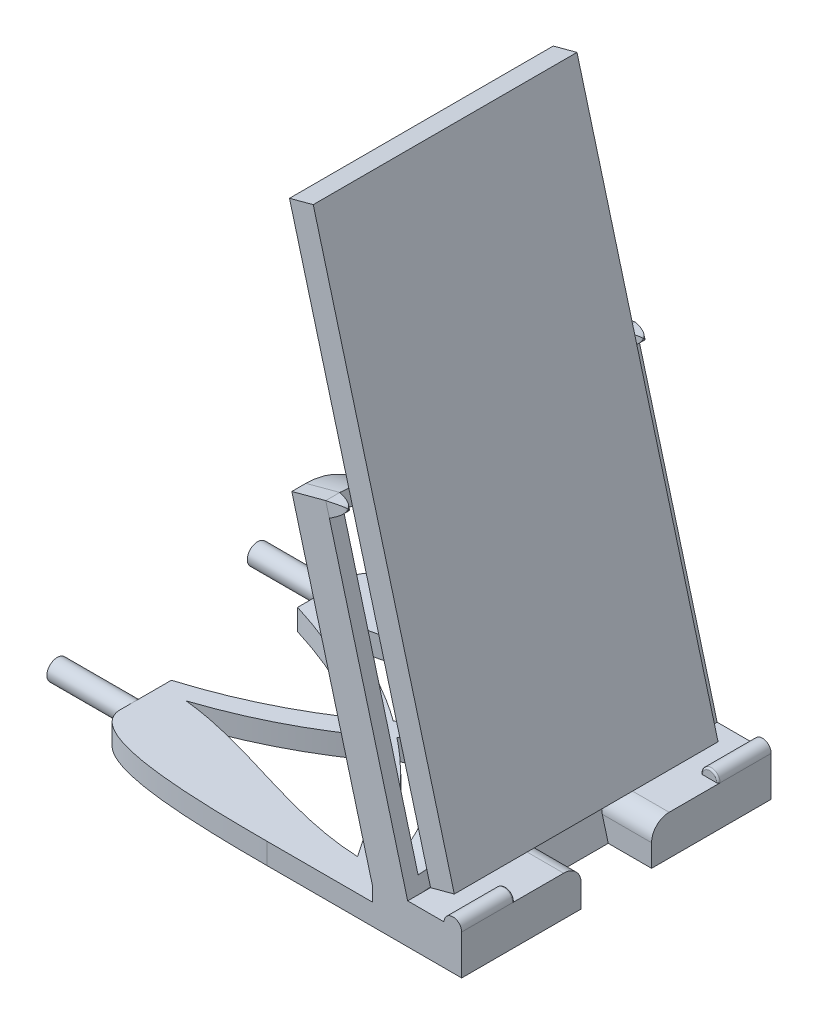
from build123d import *

# Parameters (mm, degrees)
BOSS_EXTRUDE1_DEPTH    = 44
CUT_EXTRUDE1_REACH     = 202.557
LOFT3_START            = -150.619852478
LOFT3_DEPTH            = 4.0000002
LOFT3_START_2          = 39
LOFT3_2_DEPTH          = 6
CUT_EXTRUDE2_REACH     = 181.911
SKETCH13_W             = 21.9
SKETCH13_H             = 25.5
SKETCH13_H_2           = 12.5
CUT_EXTRUDE4_START     = -21.9
CUT_EXTRUDE4_OUTLINE_W = 6
CUT_EXTRUDE4_OUTLINE_H = 6
CUT_EXTRUDE4_OUTLINE_R = 2.95
CUT_EXTRUDE4_DEPTH     = 21.9
CUT_EXTRUDE5_REACH     = 181.911
SKETCH19_W             = 5
SKETCH19_H             = 58
CUT_EXTRUDE6_DEPTH     = 178.243769107
FILLET3_R              = 0.5
SKETCH21_W             = 75
SKETCH21_H             = 155
BOSS_EXTRUDE15_DEPTH   = 6.99
SKETCH23_W             = 14.829629132
SKETCH23_H             = 20
CUT_EXTRUDE8_DEPTH     = 219.657815944
FILLET4_R              = 5
CUT_EXTRUDE12_DEPTH    = 6


with BuildPart() as part:
    # Sketch1 → Boss-Extrude1 (new, symmetric)
    with BuildSketch(Plane.XY):
        with BuildLine():
            Line((99.75217012, 182.661658891), (122.705142442, 97))
            Line((122.705142442, 97), (122.705142442, 93))
            Line((122.705142442, 93), (17.549524393, 93))
            Line((17.549524393, 93), (17.549524393, 87))
            Line((17.549524393, 87), (122.705142442, 87))
            Line((122.705142442, 87), (148.057904246, 87))
            Line((148.057904246, 87), (148.057904246, 98.316524976))
            ThreePointArc((148.057904246, 98.316524976), (145.557904246, 100.816524976), (143.057904246, 98.316524976))
            Line((143.057904246, 98.316524976), (132.705142442, 98.316524976))
            Line((132.705142442, 98.316524976), (109.411428383, 185.249849342))
            Line((109.411428383, 185.249849342), (99.75217012, 182.661658891))
        make_face()
    extrude(amount=BOSS_EXTRUDE1_DEPTH, both=True)

    # Sketch2 → Cut-Extrude1 (cut, up to next)
    with BuildSketch(Plane(origin=(148.394714749, 39.762243978, 0), x_dir=(0, 0, -1), z_dir=(0.96592582628907, 0.25881904510251486, 0)), mode=Mode.PRIVATE) as cut_extrude1_sk1:
        with BuildLine():
            ThreePointArc((-23, 125.119852378), (-26.295529926, 139.985014762), (-40, 146.619852378))
            Line((-40, 146.619852378), (-40, 64.619852378))
            ThreePointArc((-40, 64.619852378), (-26.295529926, 71.254689994), (-23, 86.119852378))
            ThreePointArc((-23, 86.119852378), (-21.898959078, 97.391608348), (-14.116878768, 105.619852378))
            ThreePointArc((-14.116878768, 105.619852378), (-21.898959078, 113.848096408), (-23, 125.119852378))
        make_face()
    cut_extrude1_tool1 = extrude(cut_extrude1_sk1.sketch, amount=-CUT_EXTRUDE1_REACH, mode=Mode.PRIVATE) & part.part
    # Sketch2 → Cut-Extrude1 (cut, up to next)
    with BuildSketch(Plane(origin=(148.394714749, 39.762243978, 0), x_dir=(0, 0, -1), z_dir=(0.96592582628907, 0.25881904510251486, 0)), mode=Mode.PRIVATE) as cut_extrude1_sk2:
        with BuildLine():
            Line((-4, 150.619852378), (-40, 150.619852378))
            ThreePointArc((-40, 150.619852378), (-24.972941073, 144.291630865), (-19, 129.119852378))
            ThreePointArc((-19, 129.119852378), (-15.264861722, 116.66035106), (-4.909694749, 108.788823379))
            ThreePointArc((-4.909694749, 108.788823379), (-3.505165356, 110.858705523), (-2.222583748, 113.0062854))
            ThreePointArc((-2.222583748, 113.0062854), (-7.034865709, 131.627661749), (-4, 150.619852378))
        make_face()
    cut_extrude1_tool2 = extrude(cut_extrude1_sk2.sketch, amount=-CUT_EXTRUDE1_REACH, mode=Mode.PRIVATE) & part.part
    # Sketch2 → Cut-Extrude1 (cut, up to next)
    with BuildSketch(Plane(origin=(148.394714749, 39.762243978, 0), x_dir=(0, 0, -1), z_dir=(0.96592582628907, 0.25881904510251486, 0)), mode=Mode.PRIVATE) as cut_extrude1_sk3:
        with BuildLine():
            ThreePointArc((-19, 82.119852378), (-24.972941073, 66.948073891), (-40, 60.619852378))
            Line((-40, 60.619852378), (-4, 60.619852378))
            ThreePointArc((-4, 60.619852378), (-7.034865709, 79.612043008), (-2.222583748, 98.233419356))
            ThreePointArc((-2.222583748, 98.233419356), (-3.505165356, 100.380999233), (-4.909694749, 102.450881377))
            ThreePointArc((-4.909694749, 102.450881377), (-15.264861722, 94.579353697), (-19, 82.119852378))
        make_face()
    cut_extrude1_tool3 = extrude(cut_extrude1_sk3.sketch, amount=-CUT_EXTRUDE1_REACH, mode=Mode.PRIVATE) & part.part
    # Sketch2 → Cut-Extrude1 (cut, up to next)
    with BuildSketch(Plane(origin=(148.394714749, 39.762243978, 0), x_dir=(0, 0, -1), z_dir=(0.96592582628907, 0.25881904510251486, 0)), mode=Mode.PRIVATE) as cut_extrude1_sk4:
        with BuildLine():
            Line((40, 150.619852378), (4, 150.619852378))
            ThreePointArc((4, 150.619852378), (7.034865709, 131.627661749), (2.222583748, 113.0062854))
            ThreePointArc((2.222583748, 113.0062854), (3.505165356, 110.858705523), (4.909694749, 108.788823379))
            ThreePointArc((4.909694749, 108.788823379), (15.264861722, 116.66035106), (19, 129.119852378))
            ThreePointArc((19, 129.119852378), (24.972941073, 144.291630865), (40, 150.619852378))
        make_face()
    cut_extrude1_tool4 = extrude(cut_extrude1_sk4.sketch, amount=-CUT_EXTRUDE1_REACH, mode=Mode.PRIVATE) & part.part
    # Sketch2 → Cut-Extrude1 (cut, up to next)
    with BuildSketch(Plane(origin=(148.394714749, 39.762243978, 0), x_dir=(0, 0, -1), z_dir=(0.96592582628907, 0.25881904510251486, 0)), mode=Mode.PRIVATE) as cut_extrude1_sk5:
        with BuildLine():
            ThreePointArc((2.222583748, 98.233419356), (7.034865709, 79.612043008), (4, 60.619852378))
            Line((4, 60.619852378), (40, 60.619852378))
            ThreePointArc((40, 60.619852378), (24.972941073, 66.948073891), (19, 82.119852378))
            ThreePointArc((19, 82.119852378), (15.264861722, 94.579353697), (4.909694749, 102.450881377))
            ThreePointArc((4.909694749, 102.450881377), (3.505165356, 100.380999233), (2.222583748, 98.233419356))
        make_face()
    cut_extrude1_tool5 = extrude(cut_extrude1_sk5.sketch, amount=-CUT_EXTRUDE1_REACH, mode=Mode.PRIVATE) & part.part
    # Sketch2 → Cut-Extrude1 (cut, up to next)
    with BuildSketch(Plane(origin=(148.394714749, 39.762243978, 0), x_dir=(0, 0, -1), z_dir=(0.96592582628907, 0.25881904510251486, 0)), mode=Mode.PRIVATE) as cut_extrude1_sk6:
        with BuildLine():
            ThreePointArc((0, 109.006393363), (-0.381722689, 108.402081473), (-0.772574463, 107.803633513))
            ThreePointArc((-0.772574463, 107.803633513), (-0.386696105, 107.755881916), (0, 107.715280877))
            ThreePointArc((0, 107.715280877), (0.386696105, 107.755881916), (0.772574463, 107.803633513))
            ThreePointArc((0.772574463, 107.803633513), (0.381722689, 108.402081473), (0, 109.006393363))
        make_face()
    cut_extrude1_tool6 = extrude(cut_extrude1_sk6.sketch, amount=-CUT_EXTRUDE1_REACH, mode=Mode.PRIVATE) & part.part
    # Sketch2 → Cut-Extrude1 (cut, up to next)
    with BuildSketch(Plane(origin=(148.394714749, 39.762243978, 0), x_dir=(0, 0, -1), z_dir=(0.96592582628907, 0.25881904510251486, 0)), mode=Mode.PRIVATE) as cut_extrude1_sk7:
        with BuildLine():
            ThreePointArc((0, 103.524423879), (-0.386696105, 103.48382284), (-0.772574463, 103.436071243))
            ThreePointArc((-0.772574463, 103.436071243), (-0.381722689, 102.837623283), (0, 102.233311394))
            ThreePointArc((0, 102.233311394), (0.381722689, 102.837623283), (0.772574463, 103.436071243))
            ThreePointArc((0.772574463, 103.436071243), (0.386696105, 103.48382284), (0, 103.524423879))
        make_face()
    cut_extrude1_tool7 = extrude(cut_extrude1_sk7.sketch, amount=-CUT_EXTRUDE1_REACH, mode=Mode.PRIVATE) & part.part
    # Sketch2 → Cut-Extrude1 (cut, up to next)
    with BuildSketch(Plane(origin=(148.394714749, 39.762243978, 0), x_dir=(0, 0, -1), z_dir=(0.96592582628907, 0.25881904510251486, 0)), mode=Mode.PRIVATE) as cut_extrude1_sk8:
        with BuildLine():
            Line((40, 64.619852378), (40, 146.619852378))
            ThreePointArc((40, 146.619852378), (26.295529926, 139.985014762), (23, 125.119852378))
            ThreePointArc((23, 125.119852378), (21.898959078, 113.848096408), (14.116878768, 105.619852378))
            ThreePointArc((14.116878768, 105.619852378), (21.898959078, 97.391608348), (23, 86.119852378))
            ThreePointArc((23, 86.119852378), (26.295529926, 71.254689994), (40, 64.619852378))
        make_face()
    cut_extrude1_tool8 = extrude(cut_extrude1_sk8.sketch, amount=-CUT_EXTRUDE1_REACH, mode=Mode.PRIVATE) & part.part
    # Sketch2 → Cut-Extrude1 (cut, up to next)
    with BuildSketch(Plane(origin=(148.394714749, 39.762243978, 0), x_dir=(0, 0, -1), z_dir=(0.96592582628907, 0.25881904510251486, 0)), mode=Mode.PRIVATE) as cut_extrude1_sk9:
        with BuildLine():
            Line((1.425485075, 146.619852378), (-1.425485075, 146.619852378))
            ThreePointArc((-1.425485075, 146.619852378), (-3.220761019, 131.987795085), (0, 117.602148947))
            ThreePointArc((0, 117.602148947), (3.220761019, 131.987795085), (1.425485075, 146.619852378))
        make_face()
    cut_extrude1_tool9 = extrude(cut_extrude1_sk9.sketch, amount=-CUT_EXTRUDE1_REACH, mode=Mode.PRIVATE) & part.part
    # Sketch2 → Cut-Extrude1 (cut, up to next)
    with BuildSketch(Plane(origin=(148.394714749, 39.762243978, 0), x_dir=(0, 0, -1), z_dir=(0.96592582628907, 0.25881904510251486, 0)), mode=Mode.PRIVATE) as cut_extrude1_sk10:
        with BuildLine():
            ThreePointArc((0, 93.637555809), (-3.220761019, 79.251909671), (-1.425485075, 64.619852378))
            Line((-1.425485075, 64.619852378), (1.425485075, 64.619852378))
            ThreePointArc((1.425485075, 64.619852378), (3.220761019, 79.251909671), (0, 93.637555809))
        make_face()
    cut_extrude1_tool10 = extrude(cut_extrude1_sk10.sketch, amount=-CUT_EXTRUDE1_REACH, mode=Mode.PRIVATE) & part.part
    add(cut_extrude1_tool1.solids().sort_by_distance((121.058285, 141.783187, 31.31958))[0], mode=Mode.SUBTRACT)
    add(cut_extrude1_tool2.solids().sort_by_distance((113.762134, 169.012796, 13.667249))[0], mode=Mode.SUBTRACT)
    add(cut_extrude1_tool3.solids().sort_by_distance((128.354437, 114.553578, 13.667249))[0], mode=Mode.SUBTRACT)
    add(cut_extrude1_tool4.solids().sort_by_distance((113.762134, 169.012796, -13.667249))[0], mode=Mode.SUBTRACT)
    add(cut_extrude1_tool5.solids().sort_by_distance((128.354437, 114.553578, -13.667249))[0], mode=Mode.SUBTRACT)
    add(cut_extrude1_tool6.solids().sort_by_distance((120.397962, 144.247547, 0))[0], mode=Mode.SUBTRACT)
    add(cut_extrude1_tool7.solids().sort_by_distance((121.718609, 139.318828, 0))[0], mode=Mode.SUBTRACT)
    add(cut_extrude1_tool8.solids().sort_by_distance((121.058285, 141.783187, -31.31958))[0], mode=Mode.SUBTRACT)
    add(cut_extrude1_tool9.solids().sort_by_distance((113.838936, 168.726164, 0))[0], mode=Mode.SUBTRACT)
    add(cut_extrude1_tool10.solids().sort_by_distance((128.277634, 114.84021, 0))[0], mode=Mode.SUBTRACT)

    # Loft3: read off the stored shape, not the designer's step
    # Loft3 outline → Loft3 (add)
    with BuildSketch(Plane(origin=(0, 0, 0), x_dir=(0.9659258262891338, 0.2588190451022763, 0), z_dir=(0.2588190451022763, -0.9659258262891338, 0)).offset(LOFT3_START)):
        with BuildLine():
            Line((153.629513478, 44), (153.629513478, 40))
            add(Edge.make_bspline(
                [(153.629513478, 40), (153.736180145, 40.026666667), (153.945246811, 40.08), (154.246046811, 40.16), (154.534046811, 40.24), (154.809246811, 40.32), (155.071646811, 40.4), (155.321246811, 40.48), (155.558046811, 40.56), (155.782046811, 40.64), (155.993246811, 40.72), (156.191646811, 40.8), (156.377246811, 40.88), (156.550046811, 40.96), (156.710046811, 41.04), (156.857246811, 41.12), (156.991646811, 41.2), (157.113246811, 41.28), (157.222046811, 41.36), (157.318046811, 41.44), (157.401246811, 41.52), (157.471646811, 41.6), (157.529246811, 41.68), (157.574046811, 41.76), (157.606046811, 41.84), (157.625246811, 41.92), (157.629513478, 41.973333333), (157.629513478, 42)],
                knots=[0, 0, 0, 0, 0.04, 0.08, 0.12, 0.16, 0.2, 0.24, 0.28, 0.32, 0.36, 0.4, 0.44, 0.48, 0.52, 0.56, 0.6, 0.64, 0.68, 0.72, 0.76, 0.8, 0.84, 0.88, 0.92, 0.96, 1, 1, 1, 1], degree=3))
            add(Edge.make_bspline(
                [(153.629513478, 44), (153.736180145, 43.973333333), (153.945246811, 43.92), (154.246046811, 43.84), (154.534046811, 43.76), (154.809246811, 43.68), (155.071646811, 43.6), (155.321246811, 43.52), (155.558046811, 43.44), (155.782046811, 43.36), (155.993246811, 43.28), (156.191646811, 43.2), (156.377246811, 43.12), (156.550046811, 43.04), (156.710046811, 42.96), (156.857246811, 42.88), (156.991646811, 42.8), (157.113246811, 42.72), (157.222046811, 42.64), (157.318046811, 42.56), (157.401246811, 42.48), (157.471646811, 42.4), (157.529246811, 42.32), (157.574046811, 42.24), (157.606046811, 42.16), (157.625246811, 42.08), (157.629513478, 42.026666667), (157.629513478, 42)],
                knots=[0, 0, 0, 0, 0.04, 0.08, 0.12, 0.16, 0.2, 0.24, 0.28, 0.32, 0.36, 0.4, 0.44, 0.48, 0.52, 0.56, 0.6, 0.64, 0.68, 0.72, 0.76, 0.8, 0.84, 0.88, 0.92, 0.96, 1, 1, 1, 1], degree=3))
        make_face()
    loft3 = extrude(amount=LOFT3_DEPTH)

    # Loft3 2 outline → Loft3 2 (cut)
    with BuildSketch(Plane.XY.offset(LOFT3_START_2)):
        with BuildLine():
            add(Edge.make_bspline(
                [(109.411428383, 185.249849342), (109.521362312, 185.251698685), (109.737108887, 185.254293076), (110.048364899, 185.254871778), (110.347257061, 185.252137597), (110.633785372, 185.246090532), (110.907949832, 185.236730584), (111.169750442, 185.224057751), (111.419187201, 185.208072035), (111.65626011, 185.188773435), (111.880969168, 185.166161951), (112.093314376, 185.140237584), (112.293295733, 185.111000332), (112.480913239, 185.078450197), (112.656166895, 185.042587178), (112.8190567, 185.003411276), (112.969582655, 184.960922489), (113.107744759, 184.915120819), (113.233543012, 184.866006265), (113.346977415, 184.813578827), (113.448047968, 184.757838506), (113.53675467, 184.6987853), (113.613097521, 184.636419211), (113.677076521, 184.570740238), (113.728691671, 184.501748382), (113.781026737, 184.405342061), (113.808634102, 184.302309973), (113.811513766, 184.192652117), (113.801309663, 184.107095842), (113.77874171, 184.018226682), (113.743809906, 183.926044639), (113.696514251, 183.830549712), (113.636854746, 183.731741902), (113.56483139, 183.629621207), (113.480444184, 183.524187629), (113.383693127, 183.415441167), (113.27457822, 183.303381821), (113.153099462, 183.188009592), (113.019256853, 183.069324478), (112.873050394, 182.947326481), (112.714480084, 182.822015601), (112.543545924, 182.693391836), (112.360247913, 182.561455187), (112.164586051, 182.426205655), (111.956560339, 182.287643239), (111.736170777, 182.145767939), (111.503417363, 182.000579756), (111.2583001, 181.852078689), (111.000818985, 181.700264738), (110.73097402, 181.545137903), (110.54283481, 181.439511424), (110.446704563, 181.386146037)],
                knots=[0, 0, 0, 0, 0.04, 0.08, 0.12, 0.16, 0.2, 0.24, 0.28, 0.32, 0.36, 0.4, 0.44, 0.48, 0.52, 0.56, 0.6, 0.64, 0.68, 0.72, 0.76, 0.8, 0.84, 0.88, 0.92, 0.96, 1.04, 1.08, 1.12, 1.16, 1.2, 1.24, 1.28, 1.32, 1.36, 1.4, 1.44, 1.48, 1.52, 1.56, 1.6, 1.64, 1.68, 1.72, 1.76, 1.8, 1.84, 1.88, 1.92, 1.96, 2, 2, 2, 2], degree=3))
            Line((110.446704563, 181.386146037), (114.310407894, 182.42142212))
            Line((114.310407894, 182.42142212), (116, 182.87414696))
            Line((116, 182.87414696), (116, 187))
            Line((116, 187), (115.943079561, 187))
            Line((115.943079561, 187), (113.275131688, 186.285125522))
            Line((113.275131688, 186.285125522), (109.411428383, 185.249849342))
        make_face()
    loft3_2 = extrude(amount=LOFT3_2_DEPTH, mode=Mode.SUBTRACT)

    # Mirror1: Loft3, Loft3 2 across plane
    add(loft3.mirror(Plane.XY))
    add(loft3_2.mirror(Plane.XY), mode=Mode.SUBTRACT)

    # Sketch13 → Cut-Extrude2 (cut, up to next)
    with BuildSketch(Plane(origin=(0, 93, 0), x_dir=(1, 0, 0), z_dir=(0, 1, 0)), mode=Mode.PRIVATE) as cut_extrude2_sk1:
        with Locations((28.499524393, 12.75)):
            Rectangle(SKETCH13_W, SKETCH13_H)
    cut_extrude2_tool1 = extrude(cut_extrude2_sk1.sketch, amount=-CUT_EXTRUDE2_REACH, mode=Mode.PRIVATE) & part.part
    # Sketch13 → Cut-Extrude2 (cut, up to next)
    with BuildSketch(Plane(origin=(0, 93, 0), x_dir=(1, 0, 0), z_dir=(0, 1, 0)), mode=Mode.PRIVATE) as cut_extrude2_sk2:
        with Locations((28.499524393, 37.75)):
            Rectangle(SKETCH13_W, SKETCH13_H_2)
    cut_extrude2_tool2 = extrude(cut_extrude2_sk2.sketch, amount=-CUT_EXTRUDE2_REACH, mode=Mode.PRIVATE) & part.part
    # Sketch13 → Cut-Extrude2 (cut, up to next)
    with BuildSketch(Plane(origin=(0, 93, 0), x_dir=(1, 0, 0), z_dir=(0, 1, 0)), mode=Mode.PRIVATE) as cut_extrude2_sk3:
        with Locations((28.499524393, -12.75)):
            Rectangle(SKETCH13_W, SKETCH13_H)
    cut_extrude2_tool3 = extrude(cut_extrude2_sk3.sketch, amount=-CUT_EXTRUDE2_REACH, mode=Mode.PRIVATE) & part.part
    # Sketch13 → Cut-Extrude2 (cut, up to next)
    with BuildSketch(Plane(origin=(0, 93, 0), x_dir=(1, 0, 0), z_dir=(0, 1, 0)), mode=Mode.PRIVATE) as cut_extrude2_sk4:
        with Locations((28.499524393, -37.75)):
            Rectangle(SKETCH13_W, SKETCH13_H_2)
    cut_extrude2_tool4 = extrude(cut_extrude2_sk4.sketch, amount=-CUT_EXTRUDE2_REACH, mode=Mode.PRIVATE) & part.part
    add(cut_extrude2_tool1.solids().sort_by_distance((28.499524, 93, -12.75))[0], mode=Mode.SUBTRACT)
    add(cut_extrude2_tool2.solids().sort_by_distance((28.499524, 93, -37.75))[0], mode=Mode.SUBTRACT)
    add(cut_extrude2_tool3.solids().sort_by_distance((28.499524, 93, 12.75))[0], mode=Mode.SUBTRACT)
    add(cut_extrude2_tool4.solids().sort_by_distance((28.499524, 93, 37.75))[0], mode=Mode.SUBTRACT)

    # Cut-Extrude4: read off the stored shape, not the designer's step
    # Cut-Extrude4 outline → Cut-Extrude4 (cut)
    with BuildSketch(Plane.ZY.offset(-17.549524393).offset(CUT_EXTRUDE4_START)):
        with Locations((-28.5, 90)):
            Rectangle(CUT_EXTRUDE4_OUTLINE_W, CUT_EXTRUDE4_OUTLINE_H)
        with Locations((-28.5, 90)):
            Circle(CUT_EXTRUDE4_OUTLINE_R, mode=Mode.SUBTRACT)
    cut_extrude4 = extrude(amount=CUT_EXTRUDE4_DEPTH, mode=Mode.SUBTRACT)

    # Mirror3: Cut-Extrude4 across plane
    add(cut_extrude4.mirror(Plane.XY), mode=Mode.SUBTRACT)

    # Sketch18 → Cut-Extrude5 (cut, up to next)
    with BuildSketch(Plane(origin=(0, 93, 0), x_dir=(1, 0, 0), z_dir=(0, 1, 0)), mode=Mode.PRIVATE) as cut_extrude5_sk1:
        with BuildLine():
            add(Edge.make_bspline(
                [(39.449524393, 32.45), (39.449524393, 42.587050158), (65.273831518, 44), (92.670407927, 44)],
                knots=[0, 0, 0, 0, 1, 1, 1, 1], degree=3))
            Line((92.670407927, 44), (39.449524393, 44))
            Line((39.449524393, 44), (39.449524393, 32.45))
        make_face()
    cut_extrude5_tool1 = extrude(cut_extrude5_sk1.sketch, amount=-CUT_EXTRUDE5_REACH, mode=Mode.PRIVATE) & part.part
    # Sketch18 → Cut-Extrude5 (cut, up to next)
    with BuildSketch(Plane(origin=(0, 93, 0), x_dir=(1, 0, 0), z_dir=(0, 1, 0)), mode=Mode.PRIVATE) as cut_extrude5_sk2:
        with BuildLine():
            add(Edge.make_bspline(
                [(39.449524393, -32.45), (39.449524393, -42.587050158), (65.273831518, -44), (92.670407927, -44)],
                knots=[0, 0, 0, 0, 1, 1, 1, 1], degree=3))
            Line((39.449524393, -32.45), (39.449524393, -44))
            Line((39.449524393, -44), (92.670407927, -44))
        make_face()
    cut_extrude5_tool2 = extrude(cut_extrude5_sk2.sketch, amount=-CUT_EXTRUDE5_REACH, mode=Mode.PRIVATE) & part.part
    add(cut_extrude5_tool1.solids().sort_by_distance((49.430263, 93, -41.752128))[0], mode=Mode.SUBTRACT)
    add(cut_extrude5_tool2.solids().sort_by_distance((49.430263, 93, 41.752128))[0], mode=Mode.SUBTRACT)

    # Sketch19 → Cut-Extrude6 (cut, through all)
    with BuildSketch(Plane(origin=(0, 98.316524976, 0), x_dir=(1, 0, 0), z_dir=(0, 1, 0))):
        with Locations((145.557904246, 0)):
            Rectangle(SKETCH19_W, SKETCH19_H)
    extrude(amount=CUT_EXTRUDE6_DEPTH, mode=Mode.SUBTRACT)

    # Fillet3
    fillet3_edges = [part.edges().sort_by_distance(p)[0] for p in [
        (145.557904246, 100.816524976, 29),
        (145.557904246, 100.816524976, -29),
    ]]
    fillet(fillet3_edges, radius=FILLET3_R)

    # Sketch23 → Cut-Extrude8 (cut, through all)
    with BuildSketch(Plane(origin=(-38.983286366, 145.487605364, 0), x_dir=(0.9659258262890705, 0.25881904510251263, 0), z_dir=(-0.25881904510251263, 0.9659258262890706, 0))):
        with Locations((161.044328044, 0)):
            Rectangle(SKETCH23_W, SKETCH23_H)
    extrude(amount=-CUT_EXTRUDE8_DEPTH, mode=Mode.SUBTRACT)

    # Fillet4
    fillet4_edges = [part.edges().sort_by_distance(p)[0] for p in [
        (140.381523344, 98.316524976, -10),
        (140.381523344, 98.316524976, 10),
    ]]
    fillet(fillet4_edges, radius=FILLET4_R)

    # Sketch26 → Cut-Extrude12 (cut)
    with BuildSketch(Plane(origin=(0, 93, 0), x_dir=(1, 0, 0), z_dir=(0, 1, 0))):
        with BuildLine():
            Line((114.705142442, -33), (114.705142442, 33))
            add(Edge.make_bspline(
                [(114.705142442, 33), (102.505323015, 13.425864783), (85.65803763, 0)],
                knots=[0, 0, 0, 0.468492232, 0.468492232, 0.468492232], degree=2))
            add(Edge.make_bspline(
                [(114.705142442, -33), (102.505323015, -13.425864783), (85.65803763, 0)],
                knots=[0, 0, 0, 0.468492232, 0.468492232, 0.468492232], degree=2))
        make_face()
        with BuildLine():
            add(Edge.make_bspline(
                [(39.449524393, 17.951275814), (53.100951746, 13.757854491), (65.399066545, 7.774095886), (76.343868791, 0)],
                knots=[0.021281256, 0.021281256, 0.021281256, 0.021281256, 0.459160105, 0.459160105, 0.459160105, 0.459160105], degree=3))
            Line((39.449524393, 17.951275814), (39.449524393, -17.951275814))
            add(Edge.make_bspline(
                [(39.449524393, -17.951275814), (53.100951746, -13.757854491), (65.399066545, -7.774095886), (76.343868791, 0)],
                knots=[0.021281256, 0.021281256, 0.021281256, 0.021281256, 0.459160105, 0.459160105, 0.459160105, 0.459160105], degree=3))
        make_face()
        with BuildLine():
            add(Edge.make_bspline(
                [(109.385577302, 34.921802017), (101.38809891, 22.55807749), (91.952017854, 12.097523549), (81.077333417, 3.540140159)],
                knots=[0.025080929, 0.025080929, 0.025080929, 0.025080929, 0.476547291, 0.476547291, 0.476547291, 0.476547291], degree=3))
            add(Edge.make_bspline(
                [(109.385577302, 34.921802017), (87.422962818, 33.897043042), (67.6918542, 23.109645974), (46.635515819, 20.931926951)],
                knots=[0.04309564, 0.04309564, 0.04309564, 0.04309564, 0.902944307, 0.902944307, 0.902944307, 0.902944307], degree=3))
            add(Edge.make_bspline(
                [(46.635515819, 20.931926951), (59.322100259, 16.708334922), (70.802705391, 10.954580801), (81.077333417, 3.540140159)],
                knots=[0.055612362, 0.055612362, 0.055612362, 0.055612362, 0.468968739, 0.468968739, 0.468968739, 0.468968739], degree=3))
        make_face()
        with BuildLine():
            add(Edge.make_bspline(
                [(109.385577301, -34.921802017), (87.422962817, -33.897043042), (67.691854199, -23.109645974), (46.635515819, -20.931926951)],
                knots=[0.04309564, 0.04309564, 0.04309564, 0.04309564, 0.902944307, 0.902944307, 0.902944307, 0.902944307], degree=3))
            add(Edge.make_bspline(
                [(109.385577301, -34.921802017), (101.38809891, -22.55807749), (91.952017854, -12.097523548), (81.077333417, -3.540140159)],
                knots=[0.025080929, 0.025080929, 0.025080929, 0.025080929, 0.476547291, 0.476547291, 0.476547291, 0.476547291], degree=3))
            add(Edge.make_bspline(
                [(46.635515819, -20.931926951), (59.322100259, -16.708334922), (70.802705391, -10.954580801), (81.077333417, -3.540140159)],
                knots=[0.055612362, 0.055612362, 0.055612362, 0.055612362, 0.468968739, 0.468968739, 0.468968739, 0.468968739], degree=3))
        make_face()
    extrude(amount=-CUT_EXTRUDE12_DEPTH, mode=Mode.SUBTRACT)


with BuildPart() as body_2:
    # Sketch21 → Boss-Extrude15 (new body)
    with BuildSketch(Plane(origin=(155.156195533, 41.573977294, 0), x_dir=(0, 0, -1), z_dir=(0.9659258262890699, 0.25881904510251497, 0))):
        with Locations((0, 138.119852378)):
            Rectangle(SKETCH21_W, SKETCH21_H)
    extrude(amount=-BOSS_EXTRUDE15_DEPTH)


solid = Compound([part.part, body_2.part])
